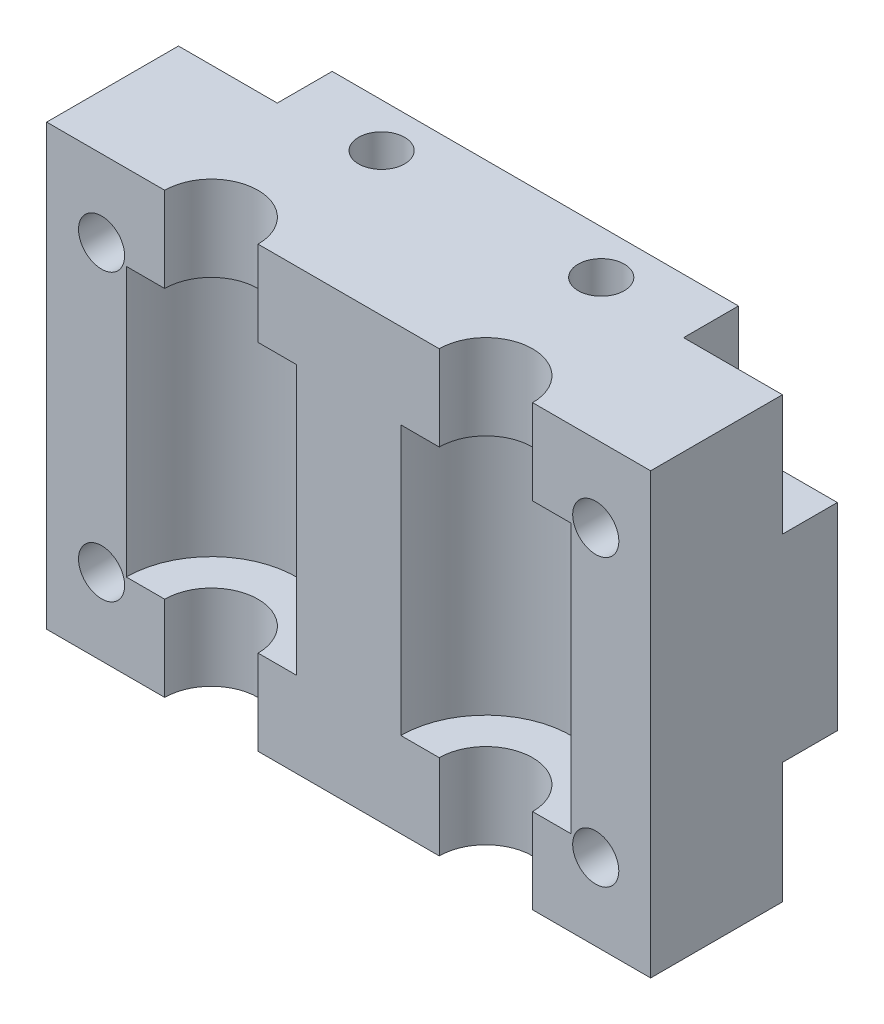
from build123d import *
from build123d.topology import SkipClean

# Parameters (mm, degrees)
ESQUISSE1_W             = 55
ESQUISSE1_H             = 45
BOSS_EXTRU_1_DEPTH      = 12
ESQUISSE2_R             = 4.25
ENL_V_MAT_EXTRU_1_DEPTH = 55.085580333
ESQUISSE3_R             = 7.75
ENL_V_MAT_EXTRU_2_DEPTH = 12.25
ESQUISSE9_W             = 61.062756781
ESQUISSE9_H             = 12.22812859
ESQUISSE9_W_2           = 59.427147224
ESQUISSE9_H_2           = 8.100161614
ENL_V_MAT_EXTRU_7_DEPTH = 31
SKETCH1_W               = 55
SKETCH1_H               = 36
BOSS_EXTRUDE1_DEPTH     = 5
SKETCH2_R               = 2.1
CUT_EXTRUDE1_DEPTH      = 38.003378224
SKETCH3_R               = 4
CUT_EXTRUDE2_DEPTH      = 10
CUT_EXTRUDE3_DEPTH      = 5
SKETCH5_R               = 2.1
CUT_EXTRUDE4_DEPTH      = 47.864165415
BOSS_EXTRUDE4_START     = 2
SKETCH7_R               = 2.1
BOSS_EXTRUDE4_DEPTH     = 2
SKETCH8_R               = 2.1
BOSS_EXTRUDE5_DEPTH     = 2
SKETCH9_W               = 7
SKETCH9_H               = 3.2
CUT_EXTRUDE6_DEPTH      = 8


with BuildPart() as part:
    # Esquisse1 → Boss.-Extru.1 (new body)
    with BuildSketch(Plane.XY):
        Rectangle(ESQUISSE1_W, ESQUISSE1_H)
    extrude(amount=BOSS_EXTRU_1_DEPTH)

    # Esquisse2 → Enlèv. mat.-Extru.1 (cut, through all)
    with BuildSketch(Plane(origin=(0, 22.5, 0), x_dir=(1, 0, 0), z_dir=(0, 1, 0))):
        with Locations((-12.5, -12)):
            Circle(ESQUISSE2_R)
        with Locations((12.5, -12)):
            Circle(ESQUISSE2_R)
    extrude(amount=-ENL_V_MAT_EXTRU_1_DEPTH, mode=Mode.SUBTRACT)

    # Esquisse3 → Enlèv. mat.-Extru.2 (cut, symmetric)
    with BuildSketch(Plane(origin=(0, 0, 0), x_dir=(1, 0, 0), z_dir=(0, 1, 0))):
        with Locations((-12.5, -12)):
            Circle(ESQUISSE3_R)
    enl_v_mat_extru_2 = extrude(amount=ENL_V_MAT_EXTRU_2_DEPTH, both=True, mode=Mode.SUBTRACT)

    # Esquisse9 → Enlèv. mat.-Extru.7 (cut)
    with BuildSketch(Plane.XY.offset(12)):
        with Locations((-0.389430846, -24.114064295)):
            Rectangle(ESQUISSE9_W, ESQUISSE9_H)
        with Locations((1.674552641, 22.050080807)):
            Rectangle(ESQUISSE9_W_2, ESQUISSE9_H_2)
    extrude(amount=-ENL_V_MAT_EXTRU_7_DEPTH, mode=Mode.SUBTRACT)

    # Sketch1 → Boss-Extrude1 (add)
    with BuildSketch(Plane(origin=(0, 0, 0), x_dir=(-1, 0, 0), z_dir=(0, 0, -1))):
        Rectangle(SKETCH1_W, SKETCH1_H)
    extrude(amount=BOSS_EXTRUDE1_DEPTH)

    # Sketch2 → Cut-Extrude1 (cut, through all)
    with BuildSketch(Plane.XY.offset(12)):
        with Locations((-22.5, 13)):
            Circle(SKETCH2_R)
        with Locations((22.5, 13)):
            Circle(SKETCH2_R)
        with Locations((22.5, -13)):
            Circle(SKETCH2_R)
        with Locations((-22.5, -13)):
            Circle(SKETCH2_R)
    extrude(amount=-CUT_EXTRUDE1_DEPTH, mode=Mode.SUBTRACT)

    # Sketch3 → Cut-Extrude2 (cut)
    with BuildSketch(Plane(origin=(0, 0, -5), x_dir=(-1, 0, 0), z_dir=(0, 0, -1))):
        with Locations((-22.5, 13)):
            Circle(SKETCH3_R)
        with Locations((22.5, 13)):
            Circle(SKETCH3_R)
        with Locations((22.5, -13)):
            Circle(SKETCH3_R)
        with Locations((-22.5, -13)):
            Circle(SKETCH3_R)
    extrude(amount=-CUT_EXTRUDE2_DEPTH, mode=Mode.SUBTRACT)

    # Sketch4 → Cut-Extrude3 (cut)
    with BuildSketch(Plane(origin=(0, 0, -5), x_dir=(-1, 0, 0), z_dir=(0, 0, -1))):
        with BuildLine():
            Line((-18.5, 13), (-18.5, 18))
            Line((-18.5, 18), (-27.5, 18))
            Line((-27.5, 18), (-27.5, 9))
            Line((-27.5, 9), (-22.5, 9))
            ThreePointArc((-22.5, 9), (-25.328427125, 15.828427125), (-18.5, 13))
        make_face()
        with BuildLine():
            Line((-22.5, -9), (-27.5, -9))
            Line((-27.5, -9), (-27.5, -18))
            Line((-27.5, -18), (-18.5, -18))
            Line((-18.5, -18), (-18.5, -13))
            ThreePointArc((-18.5, -13), (-25.328427125, -15.828427125), (-22.5, -9))
        make_face()
        with BuildLine():
            Line((27.5, -18), (27.5, -9))
            Line((27.5, -9), (22.5, -9))
            ThreePointArc((22.5, -9), (25.328427125, -15.828427125), (18.5, -13))
            Line((18.5, -13), (18.5, -18))
            Line((18.5, -18), (27.5, -18))
        make_face()
        with BuildLine():
            Line((27.5, 18), (18.5, 18))
            Line((18.5, 18), (18.5, 13))
            ThreePointArc((18.5, 13), (25.328427125, 15.828427125), (22.5, 9))
            Line((22.5, 9), (27.5, 9))
            Line((27.5, 9), (27.5, 18))
        make_face()
    extrude(amount=-CUT_EXTRUDE3_DEPTH, mode=Mode.SUBTRACT)

    # Sketch5 → Cut-Extrude4 (cut, through all)
    with BuildSketch(Plane(origin=(0, 18, 0), x_dir=(1, 0, 0), z_dir=(0, 1, 0))):
        with Locations((-10, 1)):
            Circle(SKETCH5_R)
        with Locations((10, 1)):
            Circle(SKETCH5_R)
    extrude(amount=-CUT_EXTRUDE4_DEPTH, mode=Mode.SUBTRACT)

    # Sketch7 → Boss-Extrude4 (add)
    with SkipClean():  # the faces are left unmerged after this step: merging them gives an invalid solid
        with BuildSketch(Plane(origin=(0, 18, 0), x_dir=(1, 0, 0), z_dir=(0, 1, 0)).offset(BOSS_EXTRUDE4_START)):
            with BuildLine():
                Line((18.5, 5), (-18.5, 5))
                Line((-18.5, 5), (-18.5, 0))
                Line((-18.5, 0), (-27.5, 0))
                Line((-27.5, 0), (-27.5, -12))
                Line((-27.5, -12), (-16.75, -12))
                ThreePointArc((-16.75, -12), (-12.5, -7.75), (-8.25, -12))
                Line((-8.25, -12), (8.25, -12))
                ThreePointArc((8.25, -12), (12.5, -7.75), (16.75, -12))
                Line((16.75, -12), (27.5, -12))
                Line((27.5, -12), (27.5, 0))
                Line((27.5, 0), (18.5, 0))
                Line((18.5, 0), (18.5, 5))
            make_face()
            with Locations((10, 1)):
                Circle(SKETCH7_R, mode=Mode.SUBTRACT)
            with Locations((-10, 1)):
                Circle(SKETCH7_R, mode=Mode.SUBTRACT)
        extrude(amount=-BOSS_EXTRUDE4_DEPTH)
    add(part.part.scale(1), mode=Mode.REPLACE)  # the faces are merged on a copy

    # Sketch8 → Boss-Extrude5 (add)
    with BuildSketch(Plane.XZ.offset(18)):
        with BuildLine():
            Line((-27.5, 0), (-18.5, 0))
            Line((-18.5, 0), (-18.5, -5))
            Line((-18.5, -5), (18.5, -5))
            Line((18.5, -5), (18.5, 0))
            Line((18.5, 0), (27.5, 0))
            Line((27.5, 0), (27.5, 12))
            Line((27.5, 12), (16.75, 12))
            ThreePointArc((16.75, 12), (12.5, 7.75), (8.25, 12))
            Line((8.25, 12), (-8.25, 12))
            ThreePointArc((-8.25, 12), (-12.5, 7.75), (-16.75, 12))
            Line((-16.75, 12), (-27.5, 12))
            Line((-27.5, 12), (-27.5, 0))
        make_face()
        with Locations((10, -1)):
            Circle(SKETCH8_R, mode=Mode.SUBTRACT)
        with Locations((-10, -1)):
            Circle(SKETCH8_R, mode=Mode.SUBTRACT)
    extrude(amount=BOSS_EXTRUDE5_DEPTH)

    # Sketch9 → Cut-Extrude6 (cut)
    with BuildSketch(Plane(origin=(0, 0, -5), x_dir=(-1, 0, 0), z_dir=(0, 0, -1))):
        with Locations((-10, 14.4)):
            Rectangle(SKETCH9_W, SKETCH9_H)
        with Locations((10, 14.4)):
            Rectangle(SKETCH9_W, SKETCH9_H)
        with Locations((10, -14.4)):
            Rectangle(SKETCH9_W, SKETCH9_H)
        with Locations((-10, -14.4)):
            Rectangle(SKETCH9_W, SKETCH9_H)
    extrude(amount=-CUT_EXTRUDE6_DEPTH, mode=Mode.SUBTRACT)

    # Mirror1: Enlèv. mat.-Extru.2 across plane
    add(enl_v_mat_extru_2.mirror(Plane.ZY), mode=Mode.SUBTRACT)


solid = part.part
